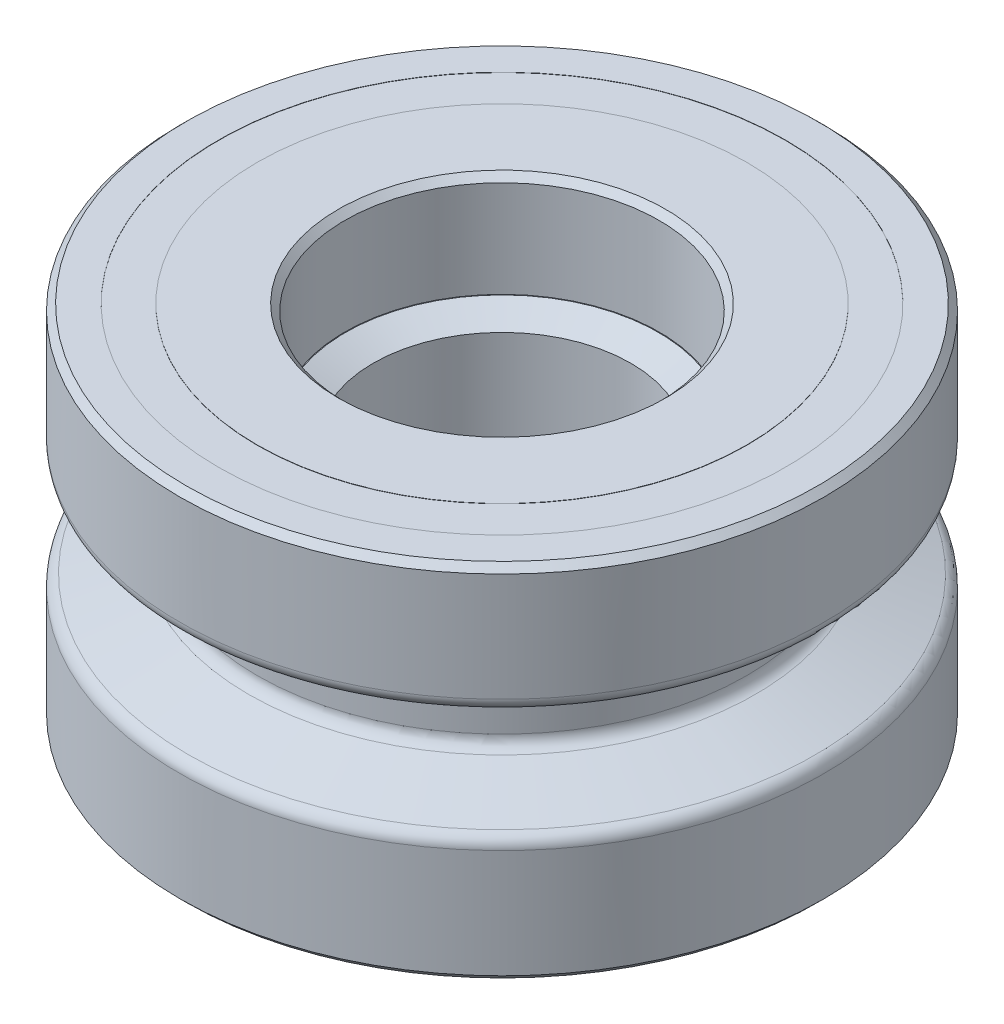
from build123d import *

# Parameters (mm, degrees)
SKETCH1_R           = 12.5
BOSS_EXTRUDE1_DEPTH = 7
CUT_EXTRUDE1_REACH  = 24.55
SKETCH2_R           = 5
SKETCH11_R          = 6.1
CUT_EXTRUDE5_DEPTH  = 4
CUT_EXTRUDE6_START  = -4
SKETCH12_R          = 6.1
CUT_EXTRUDE6_DEPTH  = 4
SKETCH7_R           = 11
SKETCH7_R_2         = 9.5
CUT_EXTRUDE4_DEPTH  = 0.01
CHAMFER2_SIZE       = 0.5
CHAMFER2_SIZE2      = 1.07225346
FILLET4_R           = 0.5
CHAMFER1_SIZE       = 0.25


with BuildPart() as part:
    # Sketch1 → Boss-Extrude1 (new, symmetric)
    with BuildSketch(Plane(origin=(0, 0, 0), x_dir=(1, 0, 0), z_dir=(0, 1, 0))):
        Circle(SKETCH1_R)
    extrude(amount=BOSS_EXTRUDE1_DEPTH, both=True)

    # Sketch2 → Cut-Extrude1 (cut, up to next)
    with BuildSketch(Plane.XZ.offset(7), mode=Mode.PRIVATE) as cut_extrude1_sk1:
        Circle(SKETCH2_R)
    cut_extrude1_tool1 = extrude(cut_extrude1_sk1.sketch, amount=-CUT_EXTRUDE1_REACH, mode=Mode.PRIVATE) & part.part
    add(cut_extrude1_tool1.solids().sort_by_distance((0, -7, 0))[0], mode=Mode.SUBTRACT)

    # Sketch11 → Cut-Extrude5 (cut)
    with BuildSketch(Plane.XZ.offset(7)):
        Circle(SKETCH11_R)
    extrude(amount=-CUT_EXTRUDE5_DEPTH, mode=Mode.SUBTRACT)

    # Sketch12 → Cut-Extrude6 (cut)
    with BuildSketch(Plane(origin=(0, 7, 0), x_dir=(1, 0, 0), z_dir=(0, 1, 0)).offset(CUT_EXTRUDE6_START)):
        Circle(SKETCH12_R)
    extrude(amount=CUT_EXTRUDE6_DEPTH, mode=Mode.SUBTRACT)

    # Sketch7 → Cut-Extrude4 (cut)
    with BuildSketch(Plane(origin=(0, 7, 0), x_dir=(1, 0, 0), z_dir=(0, 1, 0))):
        Circle(SKETCH7_R)
        Circle(SKETCH7_R_2, mode=Mode.SUBTRACT)
    extrude(amount=-CUT_EXTRUDE4_DEPTH, mode=Mode.SUBTRACT)

    # Sketch10 → Cut-Revolve1 (revolve, cut)
    with BuildSketch(Plane.XY):
        Polygon((12.5, 2.191910703), (9.5, 1.1), (9.5, -1.1), (12.5, -2.191910703), align=None)
    revolve(axis=Axis((0, 7, 0), (0, -1, 0)), mode=Mode.SUBTRACT)

    # Chamfer2
    chamfer2_edges = [part.edges().sort_by_distance(p)[0] for p in [
        (-5, 3, 0),
    ]]
    chamfer2_side = [part.faces().sort_by_distance(p)[0] for p in [
        (-5, 0, 0),
    ]]
    chamfer(chamfer2_edges, length=CHAMFER2_SIZE, length2=CHAMFER2_SIZE2, reference=chamfer2_side[0])

    # Fillet4
    fillet4_edges = [part.edges().sort_by_distance(p)[0] for p in [
        (-9.5, -1.1, 0),
        (-9.5, 1.1, 0),
        (-12.5, 2.191910703, 0),
        (-12.5, -2.191910703, 0),
    ]]
    fillet(fillet4_edges, radius=FILLET4_R)

    # Chamfer1
    chamfer1_edges = [part.edges().sort_by_distance(p)[0] for p in [
        (-12.5, -7, 0),
        (-12.5, 7, 0),
        (-6.1, -7, 0),
        (-6.1, 7, 0),
        (-5, -3, 0),
    ]]
    chamfer(chamfer1_edges, length=CHAMFER1_SIZE)


solid = part.part
